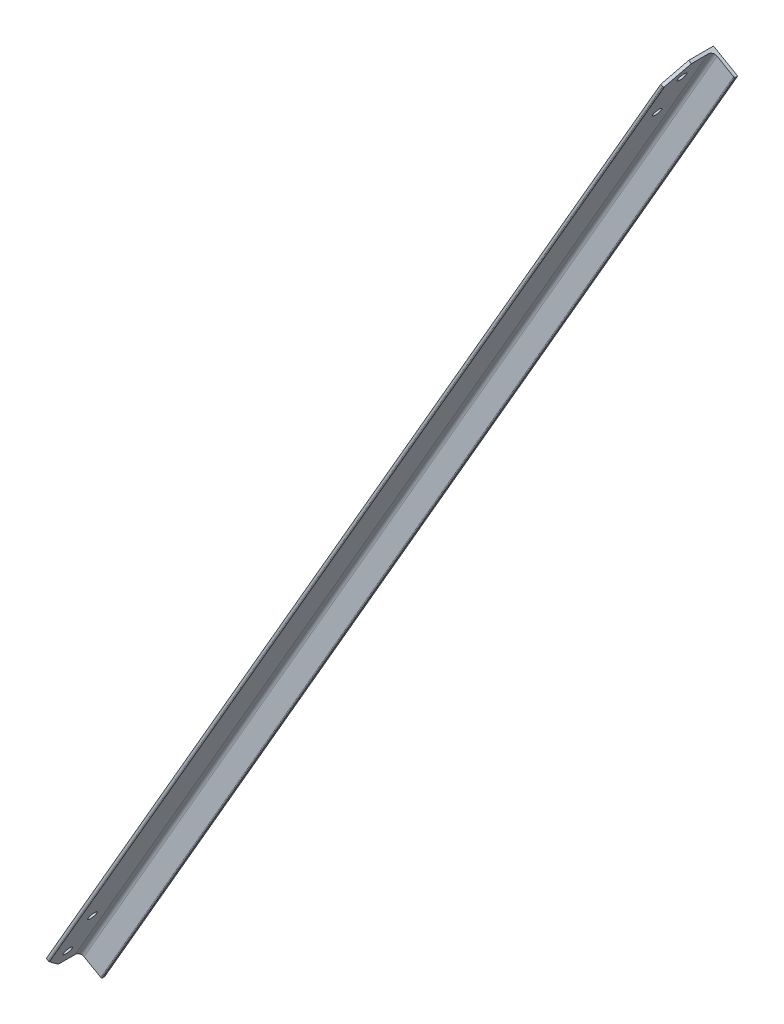
from build123d import *

# Parameters (mm, degrees)
F_70X45X5_1_DEPTH   = 2040
CUT_EXTRUDE_1_REACH = 2062.951
SKETCH_12_R         = 7
CUT_EXTRUDE_2_REACH = 2062.951
SKETCH_13_R         = 7
CHAMFER_1_SIZE      = 30
CHAMFER_2_SIZE      = 30


with BuildPart() as part:
    # 草图11 → 不等边角钢 70X45X5(1) (new body)
    with BuildSketch(Plane(origin=(1020, 1766.69182372, 0), x_dir=(0.86602540378444, -0.49999999999999784, 0), z_dir=(-0.49999999999999784, -0.86602540378444, 0))):
        with BuildLine():
            Line((0, 70), (0, 0))
            Line((0, 0), (45, 0))
            Line((45, 0), (45, 3.33))
            ThreePointArc((45, 3.33), (44.510868325, 4.510868325), (43.33, 5))
            Line((43.33, 5), (12.5, 5))
            ThreePointArc((12.5, 5), (7.196699141, 7.196699141), (5, 12.5))
            Line((5, 12.5), (5, 68.33))
            ThreePointArc((5, 68.33), (4.510868325, 69.510868325), (3.33, 70))
            Line((3.33, 70), (0, 70))
        make_face()
    extrude(amount=F_70X45X5_1_DEPTH)

    # 草图12 → 切除-拉伸1 (cut, up to next)
    with BuildSketch(Plane(origin=(0, 0, 0), x_dir=(0, 0, 1), z_dir=(-0.86602540378444, 0.49999999999999784, 0)), mode=Mode.PRIVATE) as cut_extrude_1_sk1:
        with Locations(Location((40, 30, 0), (0, 0, 270))):
            Circle(SKETCH_12_R)
    cut_extrude_1_tool1 = extrude(cut_extrude_1_sk1.sketch, amount=-CUT_EXTRUDE_1_REACH, mode=Mode.PRIVATE) & part.part
    # 草图12 → 切除-拉伸1 (cut, up to next)
    with BuildSketch(Plane(origin=(0, 0, 0), x_dir=(0, 0, 1), z_dir=(-0.86602540378444, 0.49999999999999784, 0)), mode=Mode.PRIVATE) as cut_extrude_1_sk2:
        with Locations(Location((40, 110, 0), (0, 0, 270))):
            Circle(SKETCH_12_R)
    cut_extrude_1_tool2 = extrude(cut_extrude_1_sk2.sketch, amount=-CUT_EXTRUDE_1_REACH, mode=Mode.PRIVATE) & part.part
    add(cut_extrude_1_tool1.solids().sort_by_distance((15, 25.980762, 40))[0], mode=Mode.SUBTRACT)
    add(cut_extrude_1_tool2.solids().sort_by_distance((55, 95.262794, 40))[0], mode=Mode.SUBTRACT)

    # 草图13 → 切除-拉伸2 (cut, up to next)
    with BuildSketch(Plane(origin=(0, 0, 0), x_dir=(0, 0, 1), z_dir=(-0.86602540378444, 0.49999999999999784, 0)), mode=Mode.PRIVATE) as cut_extrude_2_sk1:
        with Locations(Location((40.004723234, 1930, 0), (0, 0, 270))):
            Circle(SKETCH_13_R)
    cut_extrude_2_tool1 = extrude(cut_extrude_2_sk1.sketch, amount=-CUT_EXTRUDE_2_REACH, mode=Mode.PRIVATE) & part.part
    # 草图13 → 切除-拉伸2 (cut, up to next)
    with BuildSketch(Plane(origin=(0, 0, 0), x_dir=(0, 0, 1), z_dir=(-0.86602540378444, 0.49999999999999784, 0)), mode=Mode.PRIVATE) as cut_extrude_2_sk2:
        with Locations(Location((40.004723234, 2010, 0), (0, 0, 270))):
            Circle(SKETCH_13_R)
    cut_extrude_2_tool2 = extrude(cut_extrude_2_sk2.sketch, amount=-CUT_EXTRUDE_2_REACH, mode=Mode.PRIVATE) & part.part
    add(cut_extrude_2_tool1.solids().sort_by_distance((965, 1671.429029, 40.004723))[0], mode=Mode.SUBTRACT)
    add(cut_extrude_2_tool2.solids().sort_by_distance((1005, 1740.711062, 40.004723))[0], mode=Mode.SUBTRACT)

    # 倒角1
    # the kernel refuses this chamfer: 30 mm, written as the material it takes off along each edge
    with BuildSketch(Plane(origin=(1089.698148536, 1726.451578901, 70), x_dir=(-0.49981095845564616, -0.8656979742248816, 0.027495876610586854), z_dir=(-0.86602540378444, 0.49999999999999784, 0))) as chamfer_1_piece_1:
        Polygon((CHAMFER_1_SIZE * 0.999621916911, -CHAMFER_1_SIZE * 0.0274958766106), (-CHAMFER_1_SIZE * 0.0274958766106, -CHAMFER_1_SIZE * 0.999621916911), (0, 0), align=None)
    extrude(amount=157.630979278, mode=Mode.SUBTRACT)

    # 倒角2
    # the kernel refuses this chamfer: 30 mm, written as the material it takes off along each edge
    with BuildSketch(Plane(origin=(69.698148536, -40.240244819, 70), x_dir=(-0.013747938305293054, -0.023812127644090075, -0.9996219169112966), z_dir=(-0.86602540378444, 0.49999999999999784, 0))) as chamfer_2_piece_1:
        Polygon((CHAMFER_2_SIZE * 0.999621916911, -CHAMFER_2_SIZE * 0.0274958766106), (-CHAMFER_2_SIZE * 0.0274958766106, -CHAMFER_2_SIZE * 0.999621916911), (0, 0), align=None)
    extrude(amount=157.630979278, mode=Mode.SUBTRACT)


solid = part.part
